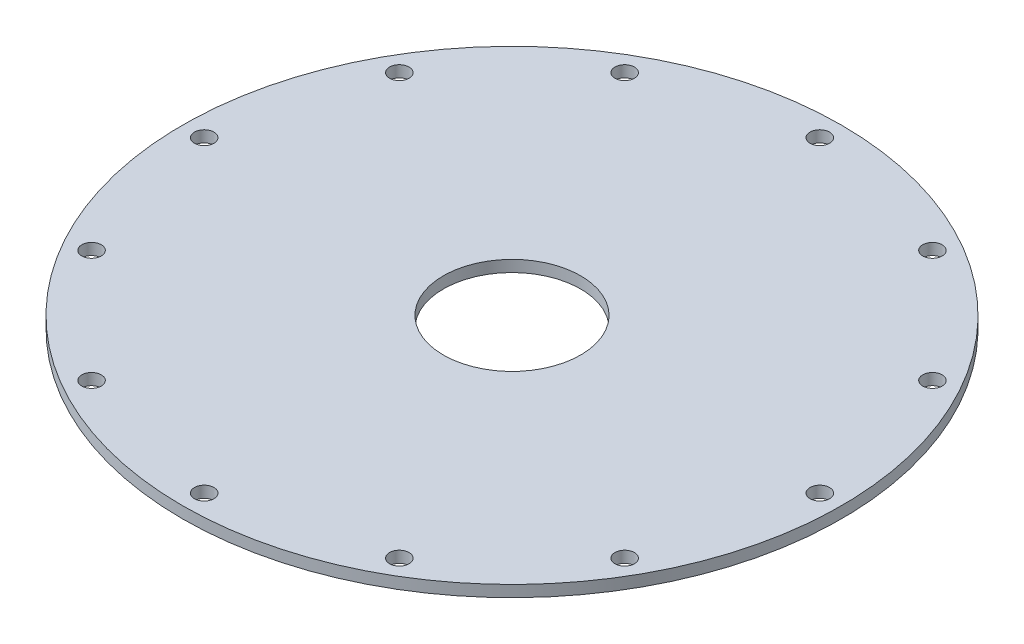
from build123d import *

# Parameters (mm, degrees)
SKETCH1_W                    = 36.195
SKETCH1_H                    = 1.5875
F_36_0_1065_DIAMETER_HOLE1_D = 2.7051
CIRPATTERN1_COUNT            = 12


with BuildPart() as part:
    # Sketch1 → Revolve1 (revolve)
    with BuildSketch(Plane.XY):
        with Locations((-27.6225, 0.79375)):
            Rectangle(SKETCH1_W, SKETCH1_H)
    revolve(axis=Axis((0, 55, 0), (0, -1, 0)))

    # #36 (0.1065) Diameter Hole1 (through all)
    with Locations(Plane(origin=(0, 1.5875, 0), x_dir=(1, 0, 0), z_dir=(0, 1, 0))):
        with Locations((-42.700575, 0)):
            f_36_0_1065_diameter_hole1 = Hole(F_36_0_1065_DIAMETER_HOLE1_D / 2)

    # CirPattern1: #36 (0.1065) Diameter Hole1 ×12 about axis
    cirpattern1_axis = Axis((0, 55, 0), (0, -1, 0))
    for i in range(1, CIRPATTERN1_COUNT):
        add(f_36_0_1065_diameter_hole1.rotate(cirpattern1_axis, i * 360 / CIRPATTERN1_COUNT), mode=Mode.SUBTRACT)


solid = part.part
